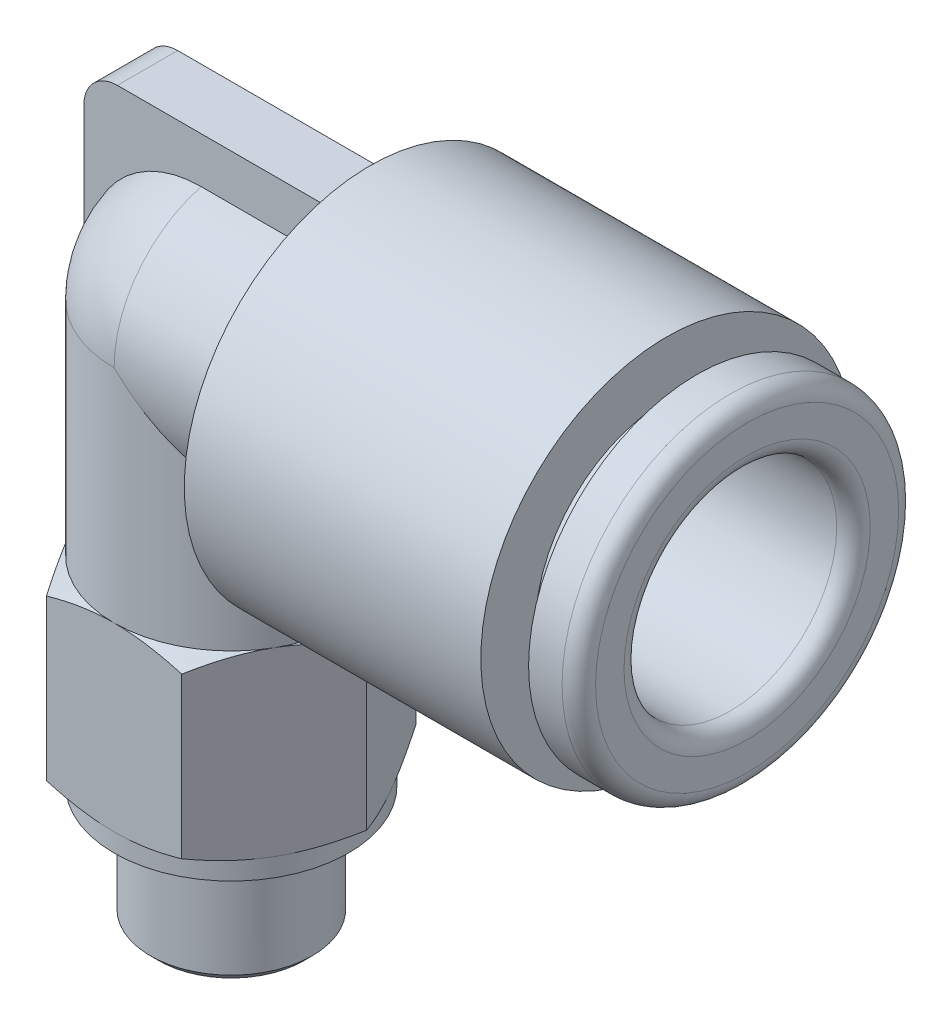
from build123d import *

# Parameters (mm, degrees)
SKETCH1_R             = 3.5
BASE_EXTRUDE_DEPTH    = 3.4
RBODY_SKETCH_R        = 5.55
RBODY_DEPTH           = 9.6
ELBOW_ANGLE           = 90
SKETCH3_R             = 3.5
BOSS_EXTRUDE1_DEPTH   = 6.6
BOSS_EXTRUDE2_DEPTH   = 0.9
NUT_DEPTH             = 5.4
THREADS_SKETCH_W      = 2.415
THREADS_SKETCH_H      = 4
THREAD_CHAMFER_SIZE   = 0.25
RTUBE_START           = -13.3
RTUBE_SKETCH_R        = 3.175
RTUBE_DEPTH           = 13.3
RTUBE_RADIUS_R        = 0.5
DIAMETER_R            = 1.25
SKETCH4_W             = 3.5
SKETCH4_H             = 0.55
PORT_THREADS_REACH    = 29.062
PORT_THREADS_SKETCH_R = 1.25


with BuildPart() as part:
    # Sketch1 → Base-Extrude (new body)
    with BuildSketch(Plane(origin=(0, 0, 0), x_dir=(0, 0, -1), z_dir=(1, 0, 0))):
        Circle(SKETCH1_R)
    extrude(amount=BASE_EXTRUDE_DEPTH)

    # RBody_Sketch → RBody (add)
    with BuildSketch(Plane(origin=(3.4, 0, 0), x_dir=(0, 0, -1), z_dir=(1, 0, 0))):
        Circle(RBODY_SKETCH_R)
    extrude(amount=RBODY_DEPTH)

    # RBody_Chamfer: read off the stored shape, not the designer's step
    # RBody_Chamfer outline → RBody_Chamfer (revolve, cut)
    with BuildSketch(Plane.YX):
        Polygon((5.55, 4.14613898), (3.5, 3.4), (5.55, 3.4), align=None)
    revolve(axis=Axis((0, 0, 0), (1, 0, 0)), mode=Mode.SUBTRACT)

    # RRelease_Sketch → RRelease (revolve)
    with BuildSketch(Plane.XY, mode=Mode.PRIVATE) as rrelease_sk:
        with BuildLine():
            Line((13, 3.925), (13.9, 3.925))
            Line((13.9, 3.925), (13.9, 5.025))
            Line((13.9, 5.025), (14.9, 5.025))
            ThreePointArc((14.9, 5.025), (15.253553391, 4.878553391), (15.4, 4.525))
            Line((15.4, 4.525), (15.4, 0))
            Line((15.4, 0), (13, 0))
            Line((13, 0), (13, 3.925))
        make_face()
    revolve(rrelease_sk.sketch.rotate(Axis((12.597722381, 0, 0), (1, 0, 0)), 90), axis=Axis((12.597722381, 0, 0), (1, 0, 0)))

    # Elbow_Sketch → Elbow (revolve)
    with BuildSketch(Plane.ZY):
        with BuildLine():
            Line((-3.5, 0), (3.5, 0))
            ThreePointArc((3.5, 0), (0, 3.5), (-3.5, 0))
        make_face()
    revolve(axis=Axis((0, 0, -6.487672297), (0, 0, 1)), revolution_arc=ELBOW_ANGLE)

    # Sketch3 → Boss-Extrude1 (add)
    with BuildSketch(Plane.XZ):
        with Locations(Location((0, 0, 0), (0, 0, 90))):
            Circle(SKETCH3_R)
    extrude(amount=BOSS_EXTRUDE1_DEPTH)

    # Sketch8 → Boss-Extrude2 (add, symmetric)
    with BuildSketch(Plane.XY):
        with BuildLine():
            Line((-3.5, -6.6), (-3.5, 3.75))
            ThreePointArc((-3.5, 3.75), (-3.207106781, 4.457106781), (-2.5, 4.75))
            Line((-2.5, 4.75), (4.14613898, 4.75))
            Line((4.14613898, 4.75), (4.14613898, 0))
            Line((4.14613898, 0), (0, 0))
            Line((0, 0), (0, -6.6))
            Line((0, -6.6), (-3.5, -6.6))
        make_face()
    extrude(amount=BOSS_EXTRUDE2_DEPTH, both=True)

    # Nut_Sketch → Nut (add)
    with BuildSketch(Plane(origin=(0, -12, 0), x_dir=(-1, 0, 0), z_dir=(0, 1, 0))):
        Polygon((4.041451884, 0), (2.020725942, 3.5), (-2.020725942, 3.5), (-4.041451884, 0), (-2.020725942, -3.5), (2.020725942, -3.5), align=None)
    extrude(amount=NUT_DEPTH)

    # Nut_Chamfer_Sketch → Nut_Chamfer (revolve, cut)
    with BuildSketch(Plane.XY):
        Polygon((-3.5, -6.6), (-4.041451884, -6.6), (-4.041451884, -6.912607391), align=None)
        Polygon((-4.041451884, -11.687392609), (-3.5, -12), (-4.041451884, -12), align=None)
    revolve(axis=Axis((0, -1.551633987, 0), (0, 1, 0)), mode=Mode.SUBTRACT)

    # Threads_Sketch → Threads (revolve)
    with BuildSketch(Plane.XY):
        with Locations((-1.2075, -14)):
            Rectangle(THREADS_SKETCH_W, THREADS_SKETCH_H)
    revolve(axis=Axis((0, 0, 0), (0, -1, 0)))

    # Thread_Chamfer
    thread_chamfer_edges = [part.edges().sort_by_distance(p)[0] for p in [
        (2.415, -16, 0),
    ]]
    chamfer(thread_chamfer_edges, length=THREAD_CHAMFER_SIZE)

    # RTube_Sketch → RTube (cut)
    with BuildSketch(Plane(origin=(15.4, 0, 0), x_dir=(0, 0, -1), z_dir=(1, 0, 0)).offset(RTUBE_START)):
        Circle(RTUBE_SKETCH_R)
    extrude(amount=RTUBE_DEPTH, mode=Mode.SUBTRACT)

    # RTube_Radius
    rtube_radius_edges = [part.edges().sort_by_distance(p)[0] for p in [
        (15.4, 0, 3.175),
    ]]
    fillet(rtube_radius_edges, radius=RTUBE_RADIUS_R)

    # Port_Curve: sweep along a path in Profile
    with BuildLine(Plane.XY) as port_curve_path:
        ThreePointArc((2.1, 0), (0.61507576, -0.61507576), (0, -2.1))
    # Diameter → Port_Curve (sweep, cut)
    with BuildSketch(Plane(origin=(2.1, 0, 0), x_dir=(0, 0, -1), z_dir=(1, 0, 0))):
        Circle(DIAMETER_R)
    sweep(path=port_curve_path.line, mode=Mode.SUBTRACT)

    # Sketch4 → Revolve1 (revolve)
    with BuildSketch(Plane.XY, mode=Mode.PRIVATE) as revolve1_sk:
        with Locations((-1.75, -12.275)):
            Rectangle(SKETCH4_W, SKETCH4_H)
    revolve(revolve1_sk.sketch.rotate(Axis((0, 0, 0), (0, -1, 0)), 180), axis=Axis((0, 0, 0), (0, -1, 0)))

    # Port_Threads_Sketch → Port_Threads (cut, up to next)
    with BuildSketch(Plane(origin=(0, -16, 0), x_dir=(-1, 0, 0), z_dir=(0, 1, 0)), mode=Mode.PRIVATE) as port_threads_sk1:
        Circle(PORT_THREADS_SKETCH_R)
    port_threads_tool1 = extrude(port_threads_sk1.sketch, amount=PORT_THREADS_REACH, mode=Mode.PRIVATE) & part.part
    add(port_threads_tool1.solids().sort_by_distance((0, -16, 0))[0], mode=Mode.SUBTRACT)


solid = part.part
